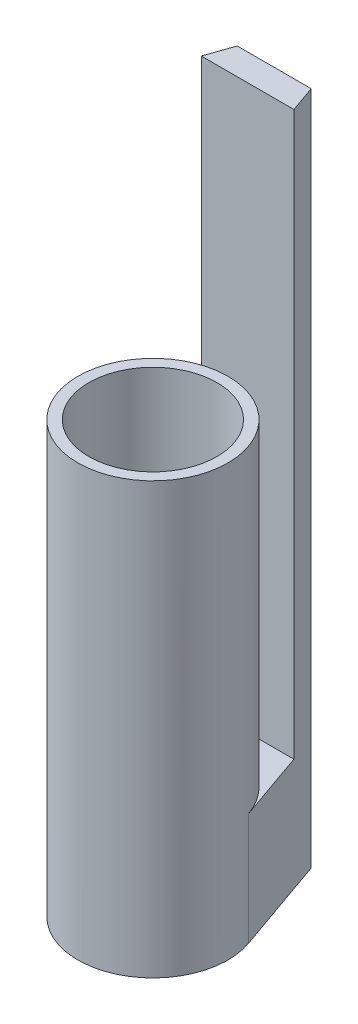
from build123d import *

# Parameters (mm, degrees)
SKETCH3_R           = 5.35
SKETCH3_R_2         = 4.57
BOSS_EXTRUDE1_DEPTH = 30.69
BOSS_EXTRUDE2_DEPTH = 8
BOSS_EXTRUDE3_DEPTH = 40.11
SKETCH3_6_R         = 4.57
BOSS_EXTRUDE4_DEPTH = 3.48


with BuildPart() as part:
    # Sketch3 → Boss-Extrude1 (new body)
    with BuildSketch(Plane(origin=(0, 0, 0), x_dir=(1, 0, 0), z_dir=(0, 1, 0))):
        Circle(SKETCH3_R)
        Circle(SKETCH3_R_2, mode=Mode.SUBTRACT)
    extrude(amount=BOSS_EXTRUDE1_DEPTH)

    # Sketch3<5> → Boss-Extrude2 (add)
    with BuildSketch(Plane(origin=(0, 0, 0), x_dir=(1, 0, 0), z_dir=(0, 1, 0))):
        with BuildLine():
            Line((-2.635, 8.65), (-5.048331501, 1.771115202))
            ThreePointArc((-5.048331501, 1.771115202), (0, 5.35), (5.048331501, 1.771115202))
            Line((5.048331501, 1.771115202), (2.635, 8.65))
            Line((2.635, 8.65), (-2.635, 8.65))
        make_face()
    extrude(amount=BOSS_EXTRUDE2_DEPTH)

    # Sketch5 → Boss-Extrude3 (add)
    with BuildSketch(Plane(origin=(0, 8, 0), x_dir=(1, 0, 0), z_dir=(0, 1, 0))):
        Polygon((-3.30158041, 6.75), (3.30158041, 6.75), (2.635, 8.65), (-2.635, 8.65), align=None)
    extrude(amount=BOSS_EXTRUDE3_DEPTH)

    # Sketch3<6> → Boss-Extrude4 (add)
    with BuildSketch(Plane(origin=(0, 0, 0), x_dir=(1, 0, 0), z_dir=(0, 1, 0))):
        Circle(SKETCH3_6_R)
    extrude(amount=BOSS_EXTRUDE4_DEPTH)


solid = part.part
